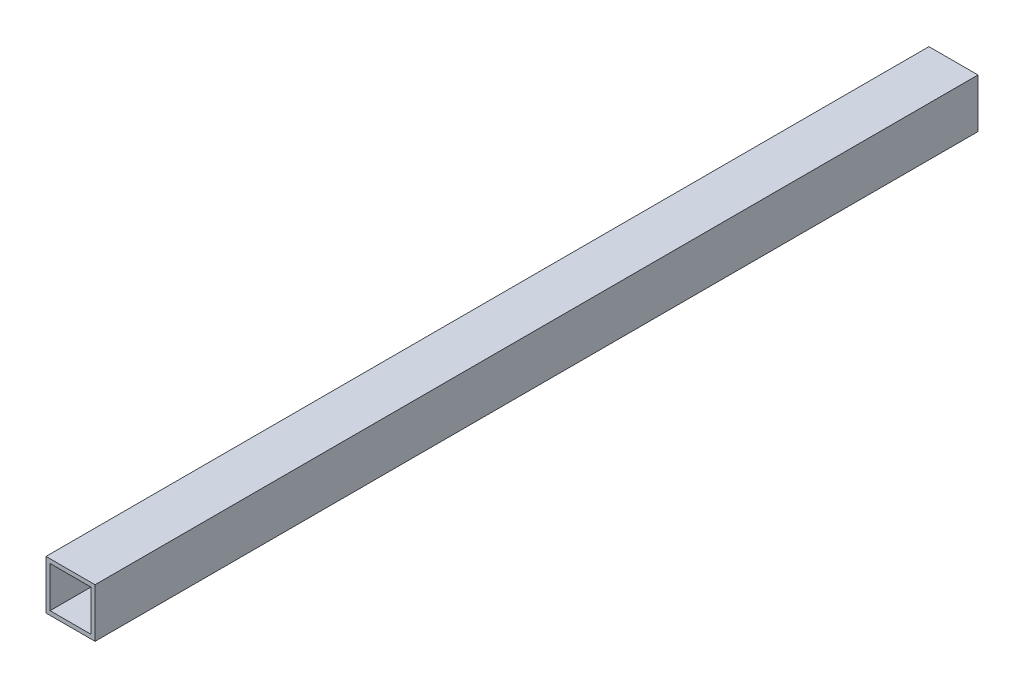
from build123d import *

# Parameters (mm, degrees)
SKETCH1_W           = 19.05
SKETCH1_H           = 19.05
SKETCH1_W_2         = 15.875
SKETCH1_H_2         = 15.875
BOSS_EXTRUDE1_DEPTH = 171.45


with BuildPart() as part:
    # Sketch1 → Boss-Extrude1 (new, symmetric)
    with BuildSketch(Plane.XY):
        Rectangle(SKETCH1_W, SKETCH1_H)
        Rectangle(SKETCH1_W_2, SKETCH1_H_2, mode=Mode.SUBTRACT)
    extrude(amount=BOSS_EXTRUDE1_DEPTH, both=True)


solid = part.part
